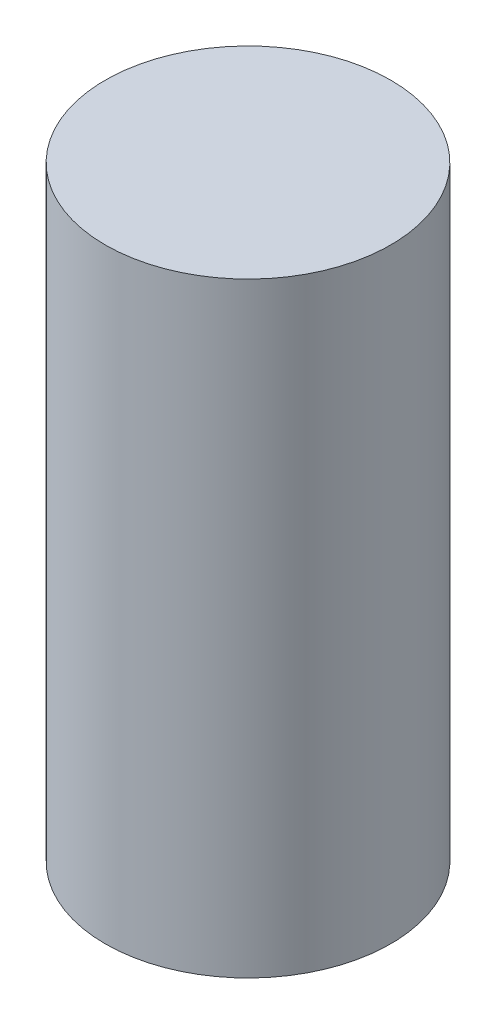
from build123d import *

# Parameters (mm, degrees)
MAIN_PARACHUTE_BAG_PROFILE_R  = 63.5
MAIN_PARACHUTE_BAG_BODY_DEPTH = 269.24


with BuildPart() as part:
    # Main Parachute Bag Profile → Main Parachute Bag Body (new body)
    with BuildSketch(Plane(origin=(0, 0, 0), x_dir=(1, 0, 0), z_dir=(0, 1, 0))):
        Circle(MAIN_PARACHUTE_BAG_PROFILE_R)
    extrude(amount=MAIN_PARACHUTE_BAG_BODY_DEPTH)


solid = part.part
